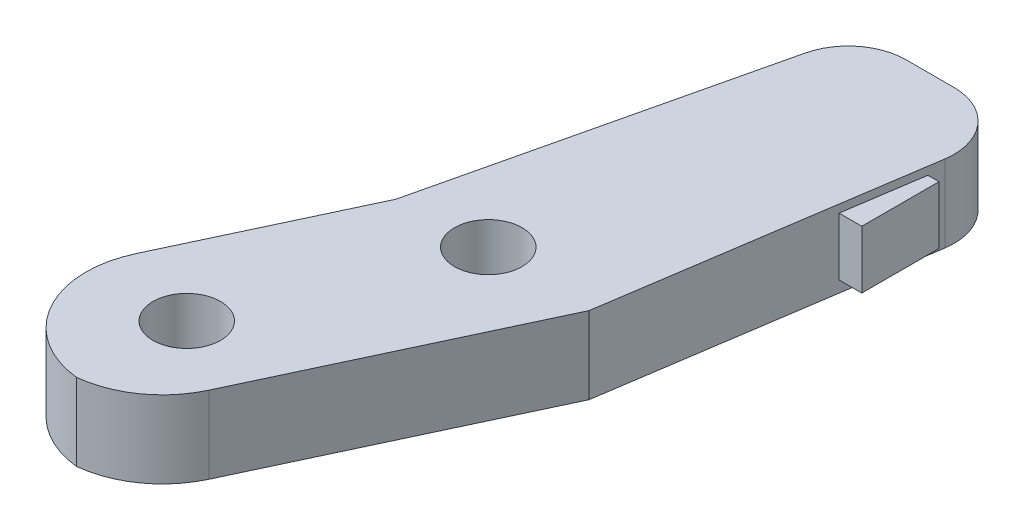
from build123d import *

# Parameters (mm, degrees)
BOSS_EXTRUDE1_DEPTH = 4
FILLET1_R           = 5
FILLET2_R           = 3
SKETCH2_R           = 1.75
CUT_EXTRUDE1_DEPTH  = 42.213228115
BOSS_EXTRUDE2_REACH = 42.084
SKETCH4_W           = 4
SKETCH4_H           = 3


with BuildPart() as part:
    # Sketch1 → Boss-Extrude1 (new body)
    with BuildSketch(Plane(origin=(0, 0, 0), x_dir=(1, 0, 0), z_dir=(0, 1, 0))):
        Polygon((0, 0), (7.627319971, 16.304109607), (12.214275277, 35.771000499), (20.559764671, 35.771000499), (17.627319971, 16.304109607), (10, 0), align=None)
    extrude(amount=BOSS_EXTRUDE1_DEPTH)

    # Fillet1
    # the kernel refuses this fillet: 5 mm, written as the material it takes off along each edge
    with BuildSketch(Plane(origin=(10, -7.952504215, 0), x_dir=(0.42373999836860227, 0, -0.9057838670359375), z_dir=(0, 1, 0))) as fillet1_piece_1:
        with BuildLine():
            CenterArc((FILLET1_R * 0.636200337192, FILLET1_R), FILLET1_R, 205.070935448, 64.929064552)
            Line((-FILLET1_R * 0.269583529844, FILLET1_R * 0.576260001631), (0, 0))
            Line((0, 0), (FILLET1_R * 0.636200337192, 0))
        make_face()
    extrude(amount=19.90500843, mode=Mode.SUBTRACT)
    with BuildSketch(Plane(origin=(0, -19.647899049, 0), x_dir=(0.42373999836860193, 0, -0.9057838670359376), z_dir=(0, 1, 0))) as fillet1_piece_2:
        with BuildLine():
            CenterArc((FILLET1_R * 1.57183192391, -FILLET1_R), FILLET1_R, 90, 115.070935448)
            Line((FILLET1_R * 0.666048056873, -FILLET1_R * 1.42373999837), (0, 0))
            Line((0, 0), (FILLET1_R * 1.57183192391, 0))
        make_face()
    extrude(amount=43.295798098, mode=Mode.SUBTRACT)

    # Fillet2
    fillet2_edges = [part.edges().sort_by_distance(p)[0] for p in [
        (12.214275277, 2, -35.771000499),
        (20.559764671, 2, -35.771000499),
    ]]
    fillet(fillet2_edges, radius=FILLET2_R)

    # Sketch2 → Cut-Extrude1 (cut, through all)
    with BuildSketch(Plane(origin=(0, 4, 0), x_dir=(1, 0, 0), z_dir=(0, 1, 0))):
        with Locations(Location((7.667711585, 5.413915862, 0), (0, 0, 270))):
            Circle(SKETCH2_R)
        with Locations(Location((12.170024678, 16.537277621, 0), (0, 0, 270))):
            Circle(SKETCH2_R)
    extrude(amount=-CUT_EXTRUDE1_DEPTH, mode=Mode.SUBTRACT)

    # Boss-Extrude2: up to this plane
    boss_extrude2_end = Plane(origin=(17.627319971, 4, -16.304109607), z_dir=(-0.9888436763539994, 0, -0.1489569861896618))
    # Sketch4 → Boss-Extrude2 (add, up to the surface)
    with BuildSketch(Plane(origin=(20.5, 0, 0), x_dir=(0, 0, -1), z_dir=(1, 0, 0)), mode=Mode.PRIVATE) as boss_extrude2_sk1:
        with Locations((29.561107497, 2.091926215)):
            Rectangle(SKETCH4_W, SKETCH4_H)
    boss_extrude2_tool1 = split(extrude(boss_extrude2_sk1.sketch, amount=-BOSS_EXTRUDE2_REACH, mode=Mode.PRIVATE), bisect_by=boss_extrude2_end, keep=Keep.BOTH, mode=Mode.PRIVATE)
    add(boss_extrude2_tool1.solids().sort_by_distance((20.5, 2.091926, -29.561107))[0])


solid = part.part
